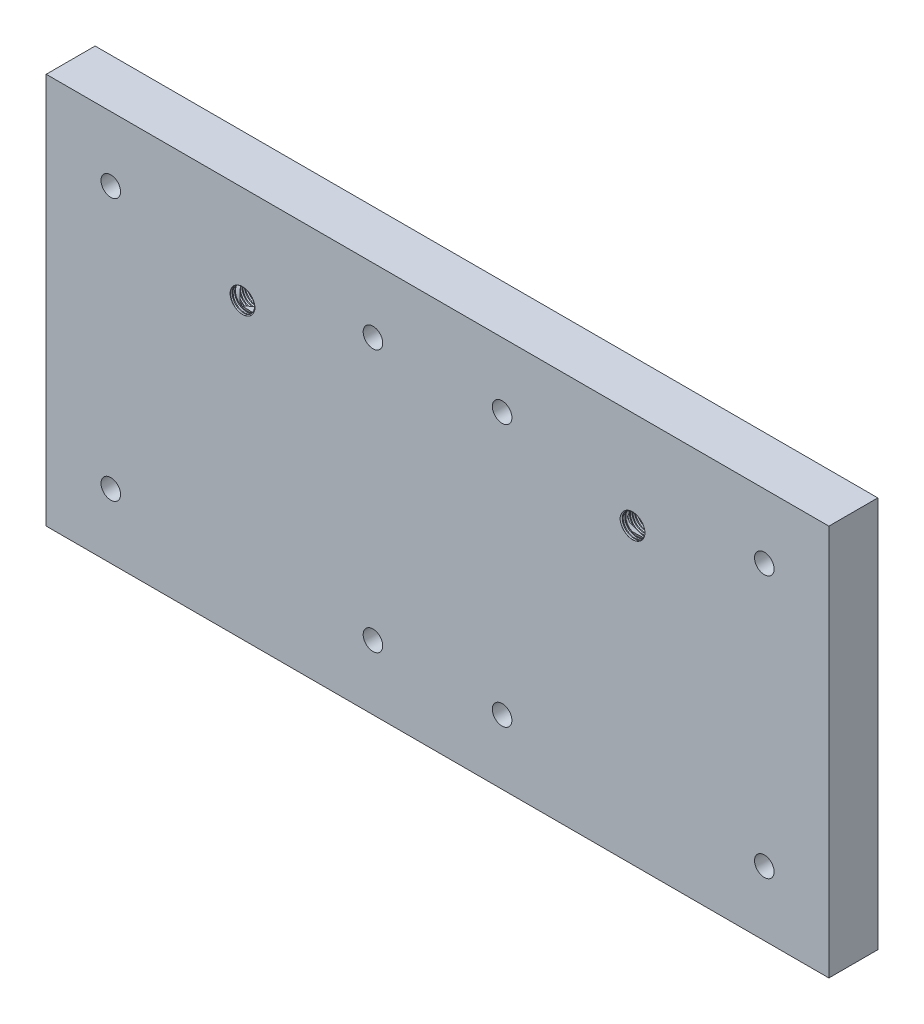
from build123d import *

# Parameters (mm, degrees)
SKETCH11_W          = 400
SKETCH11_H          = 200
BOSS_EXTRUDE1_DEPTH = 25
SKETCH13_R          = 6
SKETCH13_R_2        = 5
CUT_EXTRUDE1_DEPTH  = 412.678699595
CUT_SWEEP1_PITCH    = 1.25


with BuildPart() as part:
    # Sketch11 → Boss-Extrude1 (new body)
    with BuildSketch(Plane.XY):
        with Locations((0, 258.962883458)):
            Rectangle(SKETCH11_W, SKETCH11_H)
    extrude(amount=BOSS_EXTRUDE1_DEPTH)

    # Sketch13 → Cut-Extrude1 (cut, through all)
    with BuildSketch(Plane(origin=(0, 0, 0), x_dir=(-1, 0, 0), z_dir=(0, 0, -1))):
        with Locations((100, 308.962883458)):
            Circle(SKETCH13_R)
        with Locations(Location((-100, 308.962883458, 0), (0, 0, 180))):
            Circle(SKETCH13_R)
        with Locations((167, 325.962883458)):
            Circle(SKETCH13_R_2)
        with Locations(Location((-167, 325.962883458, 0), (0, 0, 180))):
            Circle(SKETCH13_R_2)
        with Locations(Location((33, 325.962883458, 0), (0, 0, 180))):
            Circle(SKETCH13_R_2)
        with Locations((-33, 325.962883458)):
            Circle(SKETCH13_R_2)
        with Locations((-167, 191.962883458)):
            Circle(SKETCH13_R_2)
        with Locations(Location((-33, 191.962883458, 0), (0, 0, 180))):
            Circle(SKETCH13_R_2)
        with Locations((33, 191.962883458)):
            Circle(SKETCH13_R_2)
        with Locations(Location((167, 191.962883458, 0), (0, 0, 180))):
            Circle(SKETCH13_R_2)
    extrude(amount=-CUT_EXTRUDE1_DEPTH, mode=Mode.SUBTRACT)

    # Cut-Sweep1: arcs per turn and ends read off the stored shape
    # Cut-Sweep1: the profile of Sketch15 screwed along a right-hand helix through 24.75 turns, 8 arcs to a turn; built about Z, then put on its axis
    cut_sweep1_z = Axis((0, 0, 0), (0, 0, 1))
    cut_sweep1_corners = [(5.647816336, -0.020214832, -0.640335042), (6.704367328, 0, -1.25), (5.647816336, 0.020214832, -1.859664958)]
    with BuildLine(mode=Mode.PRIVATE) as cut_sweep1_profile:
        Line(cut_sweep1_corners[0], cut_sweep1_corners[1])
        Line(cut_sweep1_corners[1], cut_sweep1_corners[2])
        Line(cut_sweep1_corners[2], cut_sweep1_corners[0])
    cut_sweep1_cap = Face(cut_sweep1_profile.wire())
    cut_sweep1_turn_angles = [0, 22.5, 45, 67.5, 90, 112.5, 135, 157.5, 180, 202.5, 225, 247.5, 270, 292.5, 315, 337.5, 360]
    cut_sweep1_turn_weights = [1, 0.9238795325112867, 1, 0.9238795325112867, 1, 0.9238795325112867, 1, 0.9238795325112867, 1, 0.9238795325112867, 1, 0.9238795325112867, 1, 0.9238795325112867, 1, 0.9238795325112867, 1]
    cut_sweep1_turn_rails = [Edge.make_bspline([Vector(p[0], p[1], 0).rotate(cut_sweep1_z, cut_sweep1_turn_angles[k]) / cut_sweep1_turn_weights[k] + Vector(0, 0, p[2] + CUT_SWEEP1_PITCH * cut_sweep1_turn_angles[k] / 360) for k in range(17)], [0, 0, 0, 1, 1, 2, 2, 3, 3, 4, 4, 5, 5, 6, 6, 7, 7, 8, 8, 8], 2, cut_sweep1_turn_weights) for p in cut_sweep1_corners]
    cut_sweep1_turn_sides = [Face.make_surface_from_curves(cut_sweep1_turn_rails[p[0]], cut_sweep1_turn_rails[p[1]]) for p in [(0, 1), (1, 2), (2, 0)]]
    cut_sweep1_last_angles = [8640, 8662.5, 8685, 8707.5, 8730, 8752.5, 8775, 8797.5, 8820, 8842.5, 8865, 8887.5, 8910]
    cut_sweep1_last_weights = [1, 0.9238795325112867, 1, 0.9238795325112867, 1, 0.9238795325112867, 1, 0.9238795325112867, 1, 0.9238795325112867, 1, 0.9238795325112867, 1]
    cut_sweep1_last_rails = [Edge.make_bspline([Vector(p[0], p[1], 0).rotate(cut_sweep1_z, cut_sweep1_last_angles[k]) / cut_sweep1_last_weights[k] + Vector(0, 0, p[2] + CUT_SWEEP1_PITCH * cut_sweep1_last_angles[k] / 360) for k in range(13)], [0, 0, 0, 1, 1, 2, 2, 3, 3, 4, 4, 5, 5, 6, 6, 6], 2, cut_sweep1_last_weights) for p in cut_sweep1_corners]
    cut_sweep1_last_sides = [Face.make_surface_from_curves(cut_sweep1_last_rails[p[0]], cut_sweep1_last_rails[p[1]]) for p in [(0, 1), (1, 2), (2, 0)]]
    cut_sweep1 = Plane(origin=(-100, 308.962883458, 0), x_dir=(1, 0, 0), z_dir=(0, 0, 1)) * Solid(Shell([*[p.moved(Location((0, 0, CUT_SWEEP1_PITCH * i))) for i in range(24) for p in cut_sweep1_turn_sides], *cut_sweep1_last_sides, cut_sweep1_cap, cut_sweep1_cap.rotate(cut_sweep1_z, 8910).moved(Location((0, 0, CUT_SWEEP1_PITCH * 8910 / 360)))]))
    add(cut_sweep1, mode=Mode.SUBTRACT)

    # Mirror1: Cut-Sweep1 across plane
    add(cut_sweep1.mirror(Plane(origin=(0, 0, 0), x_dir=(0, 0, 1), z_dir=(1, 0, 0))), mode=Mode.SUBTRACT)


solid = part.part
